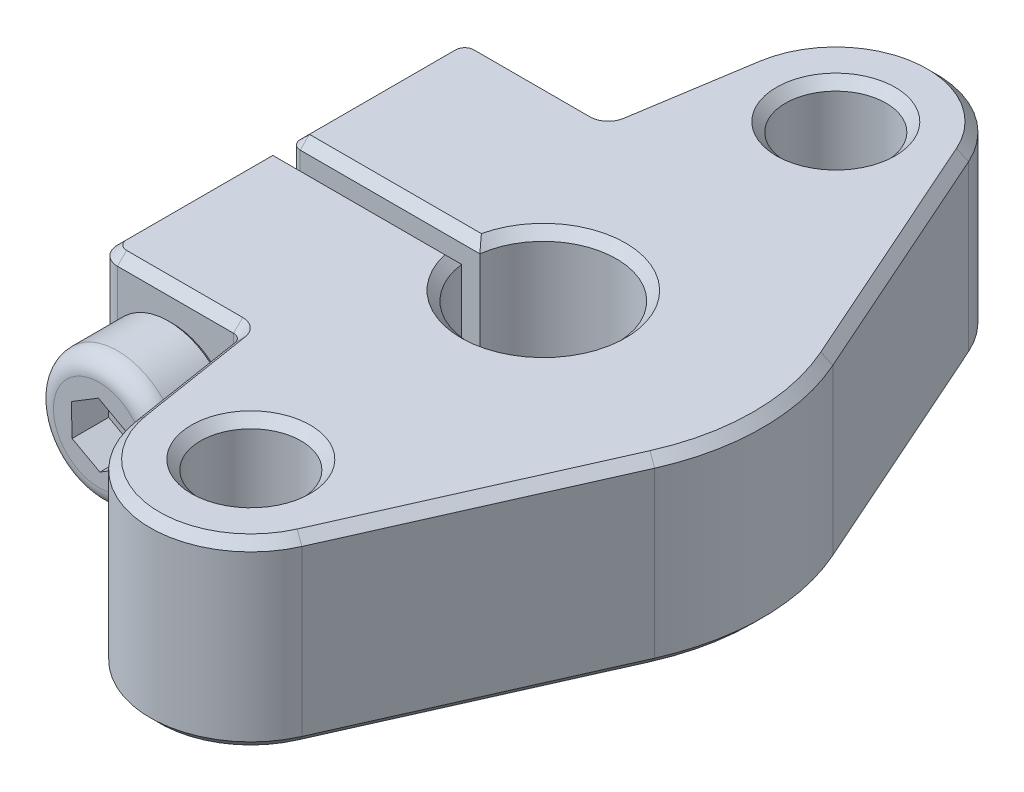
from build123d import *

# Parameters (mm, degrees)
SKETCH_1_R          = 2.75
EXTRUDE_1_DEPTH     = 10
CUT_EXTRUDE_1_REACH = 38.009
SKETCH_3_R          = 2.25
SKETCH_3_3_R        = 1.65
CUT_EXTRUDE_2_DEPTH = 37.00893353
FILLET_1_R          = 1
FILLET_2_R          = 0.5
CHAMFER_1_SIZE      = 0.5
SKETCH_4_R          = 3.5
EXTRUDE_2_DEPTH     = 4
FILLET_3_R          = 1
CUT_EXTRUDE_3_DEPTH = 2
CHAMFER_2_SIZE      = 0.2
SKETCH_6_R          = 2
EXTRUDE_3_DEPTH     = 16


with BuildPart() as part:
    # 草图1 → 凸台-拉伸1 (new body)
    with BuildSketch(Plane(origin=(0, 0, 0), x_dir=(1, 0, 0), z_dir=(0, 1, 0))):
        with BuildLine():
            ThreePointArc((5.025690834, 18.234375), (-0.716951035, 21.453070806), (-5.432446466, 16.859375))
            Line((-5.432446466, 16.859375), (-6.517551571, 10))
            Line((-6.517551571, 10), (-14.296618271, 10))
            Line((-14.296618271, 10), (-14.296618271, 0.5))
            Line((-14.296618271, 0.5), (-3.968626967, 0.5))
            ThreePointArc((-3.968626967, 0.5), (4, 0), (-3.968626967, -0.5))
            Line((-3.968626967, -0.5), (-14.296618271, -0.5))
            Line((-14.296618271, -0.5), (-14.296618271, -10))
            Line((-14.296618271, -10), (-6.517551571, -10))
            Line((-6.517551571, -10), (-5.432446466, -16.859375))
            ThreePointArc((-5.432446466, -16.859375), (-0.716951035, -21.453070806), (5.025690834, -18.234375))
            Line((5.025690834, -18.234375), (10.965143638, -4.875))
            ThreePointArc((10.965143638, -4.875), (12, 0), (10.965143638, 4.875))
            Line((10.965143638, 4.875), (5.025690834, 18.234375))
        make_face()
        with Locations(Location((0, -16, 0), (0, 0, 270))):
            Circle(SKETCH_1_R, mode=Mode.SUBTRACT)
        with Locations(Location((0, 16, 0), (0, 0, 270))):
            Circle(SKETCH_1_R, mode=Mode.SUBTRACT)
    extrude(amount=EXTRUDE_1_DEPTH)

    # 草图3 → 切除-拉伸1 (cut, up to next)
    with BuildSketch(Plane.XY.offset(10), mode=Mode.PRIVATE) as cut_extrude_1_sk1:
        with Locations((-10.296618271, 5)):
            Circle(SKETCH_3_R)
    cut_extrude_1_tool1 = extrude(cut_extrude_1_sk1.sketch, amount=-CUT_EXTRUDE_1_REACH, mode=Mode.PRIVATE) & part.part
    add(cut_extrude_1_tool1.solids().sort_by_distance((-10.296618, 5, 10))[0], mode=Mode.SUBTRACT)

    # 草图3<3> → 切除-拉伸2 (cut, through all)
    with BuildSketch(Plane.XY.offset(10)):
        with Locations(Location((-10.296618271, 5, 0), (0, 0, 180))):
            Circle(SKETCH_3_3_R)
    extrude(amount=-CUT_EXTRUDE_2_DEPTH, mode=Mode.SUBTRACT)

    # 圆角1
    fillet_1_edges = [part.edges().sort_by_distance(p)[0] for p in [
        (-14.296618271, 5, 10),
        (-14.296618271, 5, -10),
    ]]
    fillet(fillet_1_edges, radius=FILLET_1_R)

    # 圆角2
    fillet_2_edges = [part.edges().sort_by_distance(p)[0] for p in [
        (-6.517551571, 5, 10),
        (-14.296618271, 5, 0.5),
        (-14.296618271, 5, -0.5),
        (-6.517551571, 5, -10),
    ]]
    fillet(fillet_2_edges, radius=FILLET_2_R)

    # 倒角1
    chamfer_1_edges = [part.edges().sort_by_distance(p)[0] for p in [
        (-6.619913143, 0, 10.119827342),
        (-6.619913143, 10, 10.119827342),
        (-6.619913143, 0, -10.119827342),
        (-6.619913143, 10, -10.119827342),
        (-0.716951035, 10, 21.453070806),
        (7.995417236, 10, 11.5546875),
        (0, 0, 13.25),
        (0, 0, -18.75),
        (4, 0, 0),
        (12, 10, 0),
        (-5.941630183, 0, -13.640625),
        (-0.716951035, 0, -21.453070806),
        (7.995417236, 0, -11.5546875),
        (12, 0, 0),
        (7.995417236, 0, 11.5546875),
        (-0.716951035, 0, 21.453070806),
        (-5.941630183, 0, 13.640625),
        (7.995417236, 10, -11.5546875),
        (-0.716951035, 10, -21.453070806),
        (-5.941630183, 10, -13.640625),
        (4, 10, 0),
        (-14.296618271, 0, -5),
        (-14.296618271, 10, -5),
        (-10.12064547, 0, 10),
        (-10.12064547, 0, -10),
        (-14.003725052, 0, 9.707106781),
        (-14.003725052, 0, -9.707106781),
        (-10.12064547, 10, -10),
        (-5.941630183, 10, 13.640625),
        (-10.12064547, 10, 10),
        (-14.003725052, 10, 9.707106781),
        (-14.003725052, 10, -9.707106781),
        (0, 10, -18.75),
        (-8.882622619, 0, -0.5),
        (-8.882622619, 10, -0.5),
        (0, 10, 13.25),
        (-14.296618271, 0, 5),
        (-8.882622619, 0, 0.5),
        (-14.150171662, 0, 0.646446609),
        (-14.150171662, 0, -0.646446609),
        (-8.882622619, 10, 0.5),
        (-14.296618271, 10, 5),
        (-14.150171662, 10, 0.646446609),
        (-14.150171662, 10, -0.646446609),
    ]]
    chamfer(chamfer_1_edges, length=CHAMFER_1_SIZE - 0.0001)  # a hair under: the kernel refuses the full size


with BuildPart() as body_2:
    # 草图4 → 凸台-拉伸2 (new body)
    with BuildSketch(Plane.XY.offset(10)):
        with Locations((-10.296618271, 5)):
            Circle(SKETCH_4_R)
    extrude(amount=EXTRUDE_2_DEPTH)

    # 圆角3
    fillet_3_edges = [body_2.edges().sort_by_distance(p)[0] for p in [
        (-13.796618271, 5, 14),
    ]]
    fillet(fillet_3_edges, radius=FILLET_3_R)

    # 草图5 → 切除-拉伸3 (cut)
    with BuildSketch(Plane.XY.offset(14)):
        Polygon((-8.817397687, 5.901058523), (-10.33734755, 6.731571866), (-11.816568135, 5.830513342), (-11.775838856, 4.098941477), (-10.255888992, 3.268428134), (-8.776668408, 4.169486658), align=None)
    extrude(amount=-CUT_EXTRUDE_3_DEPTH, mode=Mode.SUBTRACT)

    # 倒角2
    chamfer_2_edges = [body_2.edges().sort_by_distance(p)[0] for p in [
        (-13.796618271, 5, 10),
    ]]
    chamfer(chamfer_2_edges, length=CHAMFER_2_SIZE)


with BuildPart() as body_3:
    # 草图6 → 凸台-拉伸3 (new body)
    with BuildSketch(Plane.XY.offset(10)):
        with Locations((-10.296618271, 5)):
            Circle(SKETCH_6_R)
    extrude(amount=-EXTRUDE_3_DEPTH)


solid = Compound([part.part, body_2.part, body_3.part])
